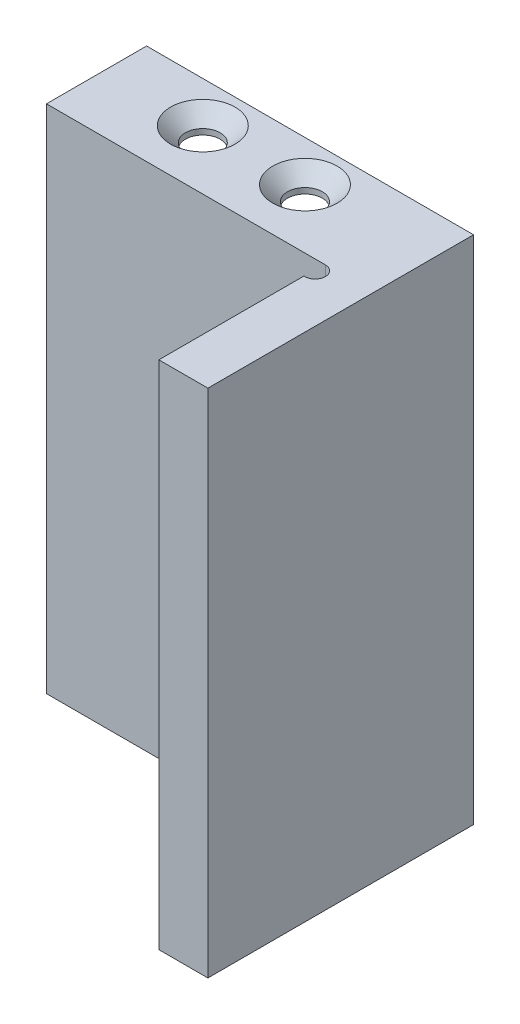
from build123d import *

# Parameters (mm, degrees)
SKIZZE1_W                                            = 32
SKIZZE1_H                                            = 26
AUFSATZ_LINEAR_AUSTRAGEN1_DEPTH                      = 2
FORMSENKUNG_F_R_M3_LINSENSENKSCHRAUBE_MI_D           = 3.4
FORMSENKUNG_F_R_M3_LINSENSENKSCHRAUBE_MI_DEPTH       = 8.5
FORMSENKUNG_F_R_M3_LINSENSENKSCHRAUBE_MI_CSINK_D     = 6.3
FORMSENKUNG_F_R_M3_LINSENSENKSCHRAUBE_MI_CSINK_ANGLE = 90
FORMSENKUNG_F_R_M3_LINSENSENKSCHRAUBE_MI_TIP         = 1.021463052
AUFSATZ_LINEAR_AUSTRAGEN2_DEPTH                      = 48
SKIZZE12_W                                           = 27.2
SKIZZE12_H                                           = 16.2
SCHNITT_LINEAR_AUSTRAGEN3_DEPTH                      = 55.083269132
F_3_2_3_2_DURCHMESSER_BOHRUNG1_D                     = 3.2
SKIZZE16_W                                           = 1.1
SKIZZE16_H                                           = 2
SCHNITT_LINEAR_AUSTRAGEN5_DEPTH                      = 55.083269132
VERRUNDUNG1_R                                        = 1


with BuildPart() as part:
    # Skizze1 → Aufsatz-Linear austragen1 (new body)
    with BuildSketch(Plane(origin=(0, 0, 0), x_dir=(1, 0, 0), z_dir=(0, 1, 0))):
        Rectangle(SKIZZE1_W, SKIZZE1_H)
    extrude(amount=AUFSATZ_LINEAR_AUSTRAGEN1_DEPTH)

    # Formsenkung für M3 Linsensenkschraube mit Schlitz1
    with Locations(Plane(origin=(0, 2, 0), x_dir=(1, 0, 0), z_dir=(0, 1, 0))):
        with Locations((-6.5, 9), (3.5, 9)):
            CounterSinkHole(FORMSENKUNG_F_R_M3_LINSENSENKSCHRAUBE_MI_D / 2, FORMSENKUNG_F_R_M3_LINSENSENKSCHRAUBE_MI_CSINK_D / 2, depth=FORMSENKUNG_F_R_M3_LINSENSENKSCHRAUBE_MI_DEPTH, counter_sink_angle=FORMSENKUNG_F_R_M3_LINSENSENKSCHRAUBE_MI_CSINK_ANGLE)
            with Locations((0, 0, -(FORMSENKUNG_F_R_M3_LINSENSENKSCHRAUBE_MI_DEPTH + FORMSENKUNG_F_R_M3_LINSENSENKSCHRAUBE_MI_TIP / 2))):  # 118° drill point
                Cone(0, FORMSENKUNG_F_R_M3_LINSENSENKSCHRAUBE_MI_D / 2, FORMSENKUNG_F_R_M3_LINSENSENKSCHRAUBE_MI_TIP, mode=Mode.SUBTRACT)

    # Skizze11 → Aufsatz-Linear austragen2 (add)
    with BuildSketch(Plane.XZ):
        Polygon((16, 13), (16, -13), (14, -13), (14, -5), (-16, -5), (-16, -3.2), (11.2, -3.2), (11.2, 13), align=None)
    extrude(amount=AUFSATZ_LINEAR_AUSTRAGEN2_DEPTH)

    # Skizze12 → Schnitt-Linear austragen3 (cut, through all)
    with BuildSketch(Plane(origin=(0, 2, 0), x_dir=(1, 0, 0), z_dir=(0, 1, 0))):
        with Locations((-2.4, -4.9)):
            Rectangle(SKIZZE12_W, SKIZZE12_H)
    extrude(amount=-SCHNITT_LINEAR_AUSTRAGEN3_DEPTH, mode=Mode.SUBTRACT)

    # Ø3.2 (3.2) Durchmesser Bohrung1 (through all)
    with Locations(Plane.XY.offset(-3.2)):
        with Locations((-1, -42.5)):
            Hole(F_3_2_3_2_DURCHMESSER_BOHRUNG1_D / 2)

    # Skizze16 → Schnitt-Linear austragen5 (cut, through all)
    with BuildSketch(Plane(origin=(0, 2, 0), x_dir=(1, 0, 0), z_dir=(0, 1, 0))):
        with Locations((11.75, 2.2)):
            Rectangle(SKIZZE16_W, SKIZZE16_H)
    extrude(amount=-SCHNITT_LINEAR_AUSTRAGEN5_DEPTH, mode=Mode.SUBTRACT)

    # Verrundung1
    verrundung1_edges = [part.edges().sort_by_distance(p)[0] for p in [
        (12.3, -23, -3.2),
        (12.3, -23, -1.2),
    ]]
    fillet(verrundung1_edges, radius=VERRUNDUNG1_R - 0.0001)  # a hair under: the kernel refuses the full size


solid = part.part
